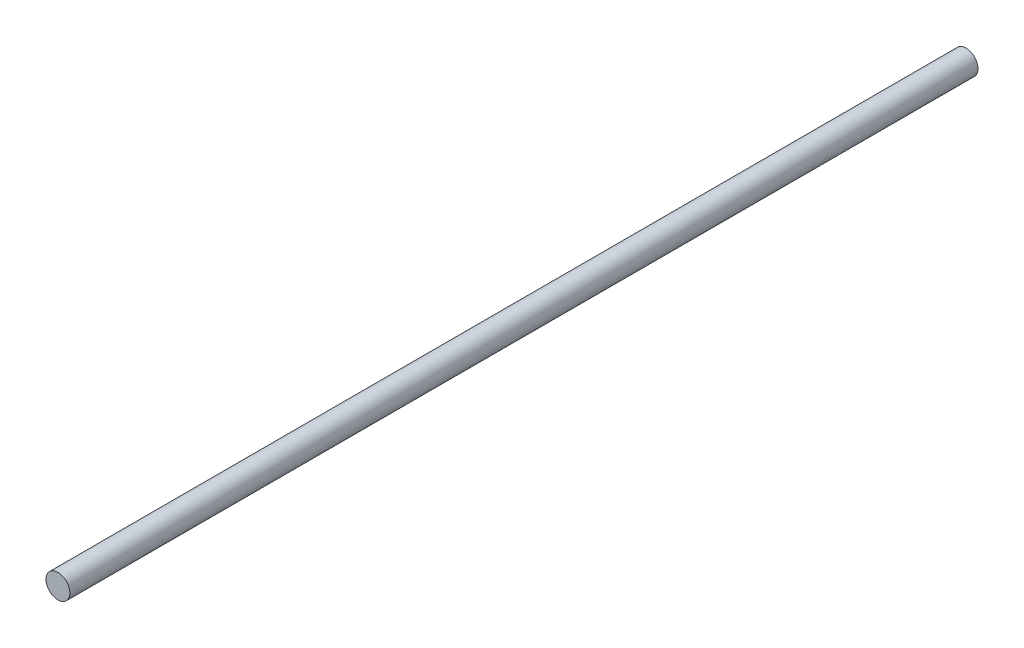
from build123d import *

# Parameters (mm, degrees)
BOSS_EXTRUDE1_DEPTH      = 2800
BOSS_EXTRUDE1_DEPTH_BACK = 1000
BASE_R                   = 50


with BuildPart() as part:
    # base → Boss-Extrude1 (new, two sides: drawn at the far end of the back side and taken through both)
    with BuildSketch(Plane.XY.offset(-BOSS_EXTRUDE1_DEPTH_BACK)):
        Circle(BASE_R)
    extrude(amount=BOSS_EXTRUDE1_DEPTH + BOSS_EXTRUDE1_DEPTH_BACK)


solid = part.part
